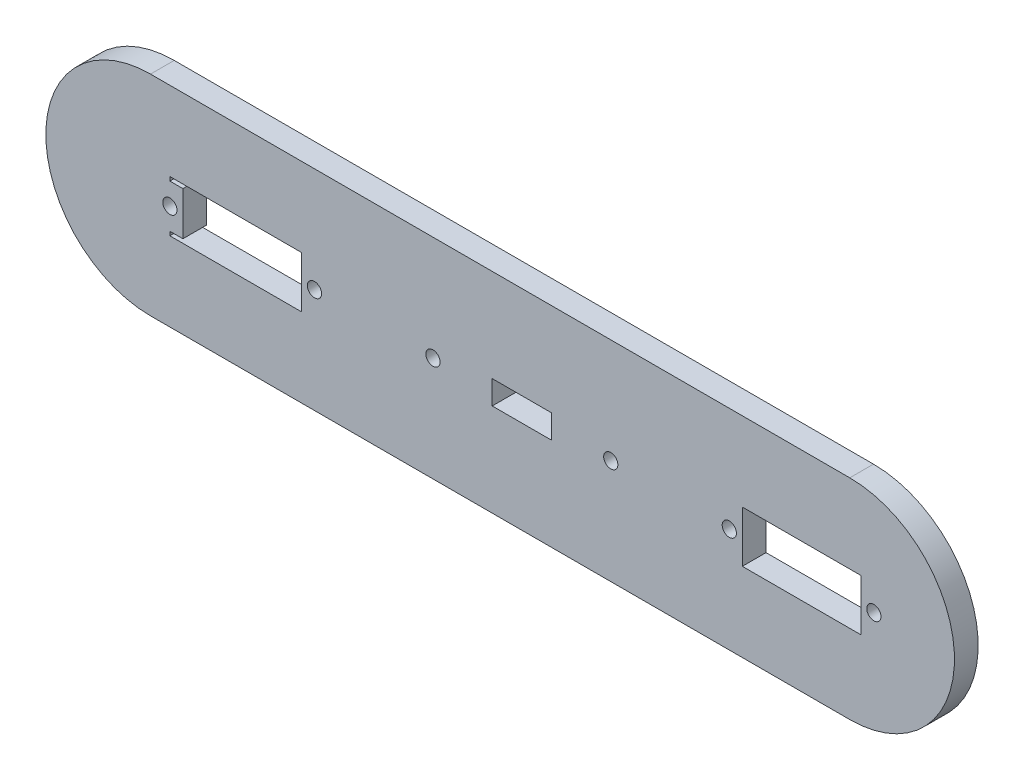
from build123d import *

# Parameters (mm, degrees)
ESBO_O1_R                = 1.8
ESBO_O1_W                = 15
ESBO_O1_H                = 6
ESBO_O1_W_2              = 30
ESBO_O1_H_2              = 13
RESSALTO_EXTRUS_O1_DEPTH = 6


with BuildPart() as part:
    # Esboço1 → Ressalto-extrusão1 (new body)
    with BuildSketch(Plane.XY):
        with BuildLine():
            Line((-94, 26.5), (83, 26.5))
            ThreePointArc((83, 26.5), (109.5, 0), (83, -26.5))
            Line((83, -26.5), (-94, -26.5))
            ThreePointArc((-94, -26.5), (-120.5, 0), (-94, 26.5))
        make_face()
        with Locations((-22.5, 0)):
            Circle(ESBO_O1_R, mode=Mode.SUBTRACT)
        with Locations((22.5, 0)):
            Circle(ESBO_O1_R, mode=Mode.SUBTRACT)
        with Locations((-89.1, 0)):
            Circle(ESBO_O1_R, mode=Mode.SUBTRACT)
        with Locations((-52.5, 0)):
            Circle(ESBO_O1_R, mode=Mode.SUBTRACT)
        with Locations((52.5, 0)):
            Circle(ESBO_O1_R, mode=Mode.SUBTRACT)
        with Locations((89.1, 0)):
            Circle(ESBO_O1_R, mode=Mode.SUBTRACT)
        Rectangle(ESBO_O1_W, ESBO_O1_H, mode=Mode.SUBTRACT)
        Polygon((-85.8, -6.5), (-55.8, -6.5), (-55.8, 6.5), (-85.8, 6.5), (-89.1, 6.5), (-89.1, 5.5), (-85.8, 5.5), (-85.8, -5.5), (-89.1, -5.5), (-89.1, -6.5), align=None, mode=Mode.SUBTRACT)
        with Locations((70.8, 0)):
            Rectangle(ESBO_O1_W_2, ESBO_O1_H_2, mode=Mode.SUBTRACT)
    extrude(amount=RESSALTO_EXTRUS_O1_DEPTH)


solid = part.part
